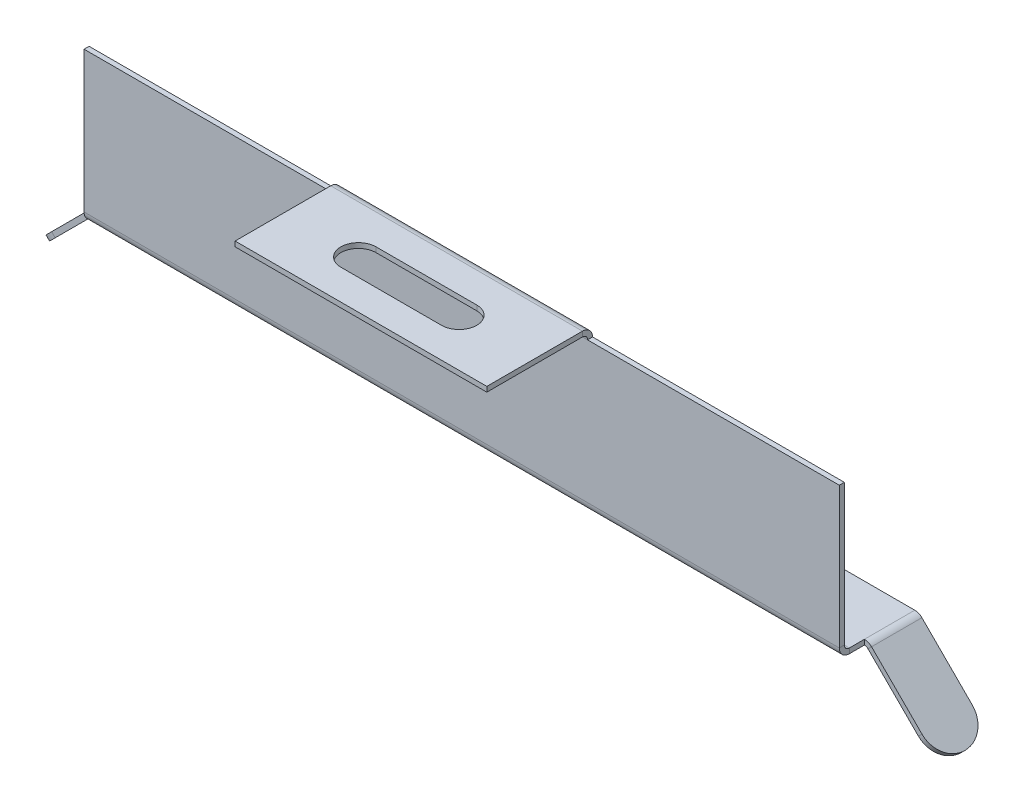
from build123d import *

# Parameters (mm, degrees)
CROQUIS1_W                       = 150
CROQUIS1_H                       = 30
BRIDA_BASE1_DEPTH                = 1
BRIDA_DE_ARISTA1_DEPTH           = 50
BRIDA_DE_ARISTA2_STRIP_W         = 6
BRIDA_DE_ARISTA2_STRIP_H         = 1
BRIDA_DE_ARISTA2_STRIP_CUT_DEPTH = 150
BRIDA_DE_ARISTA2_DEPTH           = 150
BRIDA_DE_ARISTA3_DEPTH           = 10
BRIDA_DE_ARISTA3_BEND_DEPTH      = 10
REDONDEO1_RADIUS                 = 5
REDONDEO1_LENGTH                 = 1
REDONDEO2_RADIUS                 = 5
REDONDEO2_LENGTH                 = 1
CORTAR_EXTRUIR1_DEPTH            = 10


# Sheet-metal steps are written as plain solids
with BuildPart() as part:
    # Croquis1 → Brida base1 (new body)
    with BuildSketch(Plane.XY):
        Rectangle(CROQUIS1_W, CROQUIS1_H)
    extrude(amount=-BRIDA_BASE1_DEPTH)

    # Brida de arista1 section (across the edge) → Brida de arista1 (add)
    with BuildSketch(Plane(origin=(25, 16, 0), x_dir=(0, -1, 0), z_dir=(-1, 0, 0))):
        with BuildLine():
            Line((-1, 1), (-1, 20))
            Line((-1, 20), (0, 20))
            Line((0, 20), (0, 1))
            ThreePointArc((0, 1), (0.292893219, 0.292893219), (1, 0))
            Line((1, 0), (1, -1))
            ThreePointArc((1, -1), (-0.414213562, -0.414213562), (-1, 1))
        make_face()
    extrude(amount=BRIDA_DE_ARISTA1_DEPTH)

    # Brida de arista2 strip (across the edge) → Brida de arista2 strip cut (cut)
    with BuildSketch(Plane(origin=(75, -15, -1), x_dir=(0, 1, 0), z_dir=(-1, 0, 0))):
        with Locations((-1, -0.5)):
            Rectangle(BRIDA_DE_ARISTA2_STRIP_W, BRIDA_DE_ARISTA2_STRIP_H)
    extrude(amount=BRIDA_DE_ARISTA2_STRIP_CUT_DEPTH, mode=Mode.SUBTRACT)

    # Brida de arista2 section (across the edge) → Brida de arista2 (add)
    with BuildSketch(Plane(origin=(75, -15, -1), x_dir=(0, 1, 0), z_dir=(-1, 0, 0))):
        with BuildLine():
            Line((0, 1), (0, 14))
            Line((0, 14), (1, 14))
            Line((1, 14), (1, 1))
            ThreePointArc((1, 1), (1.292893219, 0.292893219), (2, 0))
            Line((2, 0), (2, -1))
            ThreePointArc((2, -1), (0.585786438, -0.414213562), (0, 1))
        make_face()
    extrude(amount=BRIDA_DE_ARISTA2_DEPTH)

    # Brida de arista3 section (across the edge) → Brida de arista3 (add)
    with BuildSketch(Plane(origin=(-75.414213562, -15, -5), x_dir=(0.7071067811865439, -0.7071067811865511, 1.6984173230954452e-15), z_dir=(0, 0, -1))):
        with BuildLine():
            Line((-1, 0.414213562), (-1, 19.585786438))
            Line((-1, 19.585786438), (0, 19.585786438))
            Line((0, 19.585786438), (0, 0.414213562))
            ThreePointArc((0, 0.414213562), (0.076120467, 0.03153013), (0.292893219, -0.292893219))
            Line((0.292893219, -0.292893219), (-0.414213562, -1))
            ThreePointArc((-0.414213562, -1), (-0.847759065, -0.351153302), (-1, 0.414213562))
        make_face()
    extrude(amount=BRIDA_DE_ARISTA3_DEPTH)

    # Brida de arista3 section 2 (across the edge) → Brida de arista3 bend (add)
    with BuildSketch(Plane(origin=(75.414213562, -15, -15), x_dir=(-0.7071067811865437, -0.7071067811865513, 3.0194085743918815e-15), z_dir=(0, 0, 1))):
        with BuildLine():
            Line((-1, 0.414213562), (-1, 19.585786438))
            Line((-1, 19.585786438), (0, 19.585786438))
            Line((0, 19.585786438), (0, 0.414213562))
            ThreePointArc((0, 0.414213562), (0.076120467, 0.03153013), (0.292893219, -0.292893219))
            Line((0.292893219, -0.292893219), (-0.414213562, -1))
            ThreePointArc((-0.414213562, -1), (-0.847759065, -0.351153302), (-1, 0.414213562))
        make_face()
    extrude(amount=BRIDA_DE_ARISTA3_BEND_DEPTH)

    # Redondeo1: full round fillet: the end face becomes a half cylinder, R = half its width
    redondeo1_face = Plane((-89.617009358, -28.495689014, -10), x_dir=(-0.707106781187, 0.707106781187, 0), z_dir=(-0.707106781187, -0.707106781187, 0))  # on the end face: x along it, z out of the body
    redondeo1_slab = redondeo1_face.offset(-REDONDEO1_RADIUS / 2) * Box(REDONDEO1_LENGTH, 2 * REDONDEO1_RADIUS, REDONDEO1_RADIUS, mode=Mode.PRIVATE)  # the body's end, R deep
    redondeo1_round = Plane((-86.081475452, -24.960155108, -10), x_dir=(-0.707106781187, -0.707106781187, 0), z_dir=(-0.707106781187, 0.707106781187, 0)) * Cylinder(REDONDEO1_RADIUS, REDONDEO1_LENGTH, mode=Mode.PRIVATE)  # its axis R under the face
    add(redondeo1_slab - redondeo1_round, mode=Mode.SUBTRACT)

    # Redondeo2: full round fillet: the end face becomes a half cylinder, R = half its width
    redondeo2_face = Plane((89.617009358, -28.495689014, -10), x_dir=(0.707106781187, 0.707106781187, 0), z_dir=(0.707106781187, -0.707106781187, 0))  # on the end face: x along it, z out of the body
    redondeo2_slab = redondeo2_face.offset(-REDONDEO2_RADIUS / 2) * Box(REDONDEO2_LENGTH, 2 * REDONDEO2_RADIUS, REDONDEO2_RADIUS, mode=Mode.PRIVATE)  # the body's end, R deep
    redondeo2_round = Plane((86.081475452, -24.960155108, -10), x_dir=(0.707106781187, -0.707106781187, 0), z_dir=(0.707106781187, 0.707106781187, 0)) * Cylinder(REDONDEO2_RADIUS, REDONDEO2_LENGTH, mode=Mode.PRIVATE)  # its axis R under the face
    add(redondeo2_slab - redondeo2_round, mode=Mode.SUBTRACT)

    # Croquis18 → Cortar-Extruir1 (cut)
    with BuildSketch(Plane(origin=(0, 17, 0), x_dir=(1, 0, 0), z_dir=(0, 1, 0))):
        with BuildLine():
            Line((10, -14), (-10, -14))
            ThreePointArc((-10, -14), (-13.5, -10.5), (-10, -7))
            Line((-10, -7), (10, -7))
            ThreePointArc((10, -7), (13.5, -10.5), (10, -14))
        make_face()
    extrude(amount=-CORTAR_EXTRUIR1_DEPTH, mode=Mode.SUBTRACT)


solid = part.part
